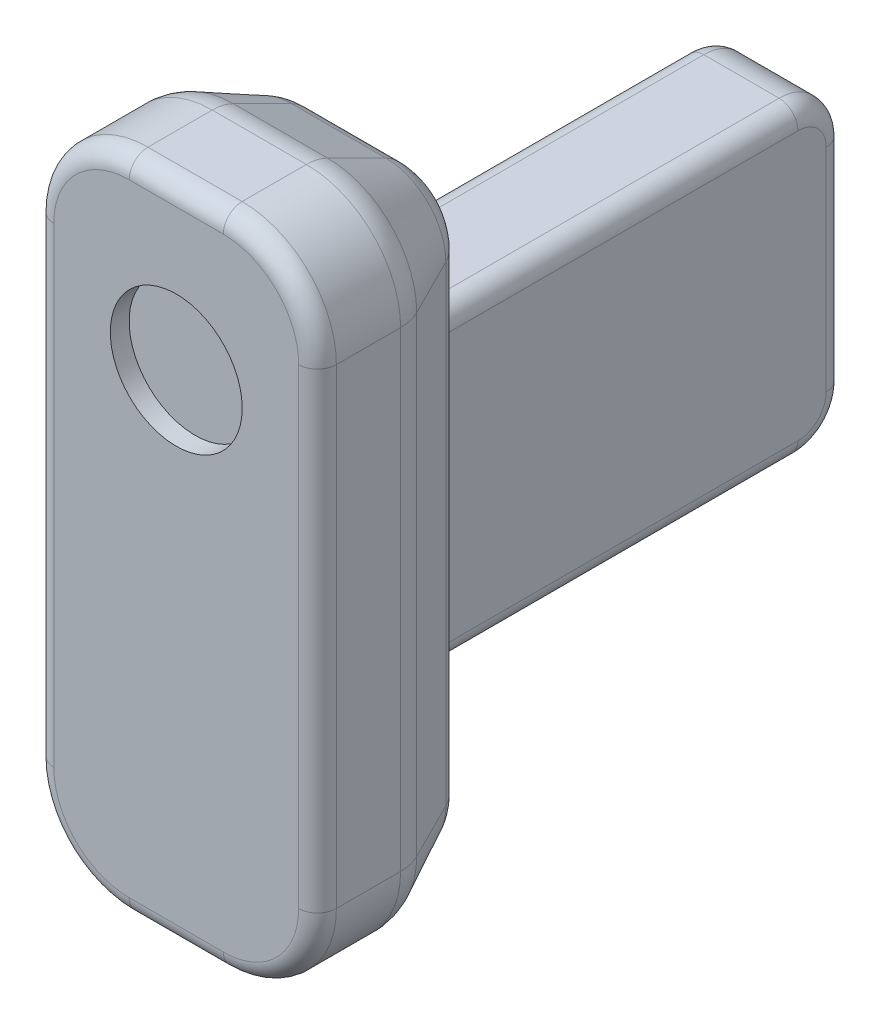
from build123d import *

# Parameters (mm, degrees)
SKETCH1_W           = 30
SKETCH1_H           = 70
BOSS_EXTRUDE1_DEPTH = 20
FILLET1_R           = 10
FILLET2_R           = 2
CHAMFER1_SIZE       = 5
CHAMFER1_SIZE2      = 10
FILLET3_R           = 5
SKETCH2_W           = 12
SKETCH2_H           = 32.5
BOSS_EXTRUDE2_DEPTH = 45
FILLET4_R           = 5
SKETCH3_R           = 7
CUT_EXTRUDE1_DEPTH  = 2
FILLET5_R           = 2


with BuildPart() as part:
    # Sketch1 → Boss-Extrude1 (new body)
    with BuildSketch(Plane.XY):
        with Locations((57.367254616, -81.313756287)):
            Rectangle(SKETCH1_W, SKETCH1_H)
    extrude(amount=-BOSS_EXTRUDE1_DEPTH)

    # Fillet1
    fillet1_edges = [part.edges().sort_by_distance(p)[0] for p in [
        (42.367254616, -46.313756287, -10),
        (72.367254616, -46.313756287, -10),
        (42.367254616, -116.313756287, -10),
        (72.367254616, -116.313756287, -10),
    ]]
    fillet(fillet1_edges, radius=FILLET1_R)

    # Fillet2
    fillet2_edges = [part.edges().sort_by_distance(p)[0] for p in [
        (69.438322428, -113.384824099, 0),
        (57.367254616, -116.313756287, 0),
        (45.296186805, -113.384824099, 0),
        (42.367254616, -81.313756287, 0),
        (45.296186805, -49.242688475, 0),
        (57.367254616, -46.313756287, 0),
        (69.438322428, -49.242688475, 0),
        (72.367254616, -81.313756287, 0),
    ]]
    fillet(fillet2_edges, radius=FILLET2_R)

    # Chamfer1
    chamfer1_edges = [part.edges().sort_by_distance(p)[0] for p in [
        (42.367254616, -81.313756287, -20),
        (45.296186805, -113.384824099, -20),
        (45.296186805, -49.242688475, -20),
        (57.367254616, -116.313756287, -20),
        (57.367254616, -46.313756287, -20),
        (69.438322428, -113.384824099, -20),
        (69.438322428, -49.242688475, -20),
        (72.367254616, -81.313756287, -20),
    ]]
    chamfer1_side = [part.faces().sort_by_distance(p)[0] for p in [
        (57.367254616, -81.313756287, -20),
    ]]
    chamfer(chamfer1_edges, length=CHAMFER1_SIZE, length2=CHAMFER1_SIZE2, reference=chamfer1_side[0])

    # Fillet3
    fillet3_edges = [part.edges().sort_by_distance(p)[0] for p in [
        (65.902788522, -52.778222381, -20),
        (57.367254616, -51.313756287, -20),
        (48.83172071, -52.778222381, -20),
        (47.367254616, -81.313756287, -20),
        (48.83172071, -109.849290193, -20),
        (57.367254616, -111.313756287, -20),
        (65.902788522, -109.849290193, -20),
        (69.438322428, -113.384824099, -10),
        (57.367254616, -116.313756287, -10),
        (45.296186805, -113.384824099, -10),
        (42.367254616, -81.313756287, -10),
        (45.296186805, -49.242688475, -10),
        (57.367254616, -46.313756287, -10),
        (69.438322428, -49.242688475, -10),
        (67.367254616, -81.313756287, -20),
        (72.367254616, -81.313756287, -10),
    ]]
    fillet(fillet3_edges, radius=FILLET3_R)

    # Sketch2 → Boss-Extrude2 (add)
    with BuildSketch(Plane(origin=(0, 0, -20), x_dir=(-1, 0, 0), z_dir=(0, 0, -1))):
        with Locations((-57.367254616, -82.563756287)):
            Rectangle(SKETCH2_W, SKETCH2_H)
    extrude(amount=BOSS_EXTRUDE2_DEPTH)

    # Fillet4
    fillet4_edges = [part.edges().sort_by_distance(p)[0] for p in [
        (57.367254616, -66.313756287, -65),
        (57.367254616, -98.813756287, -65),
    ]]
    fillet(fillet4_edges, radius=FILLET4_R)

    # Sketch3 → Cut-Extrude1 (cut)
    with BuildSketch(Plane.XY):
        with Locations((57.367254616, -63.313756287)):
            Circle(SKETCH3_R)
    extrude(amount=-CUT_EXTRUDE1_DEPTH, mode=Mode.SUBTRACT)

    # Fillet5
    fillet5_edges = [part.edges().sort_by_distance(p)[0] for p in [
        (51.367254616, -66.313756287, -40),
        (51.367254616, -67.778222381, -63.535533906),
        (51.367254616, -82.563756287, -65),
        (51.367254616, -97.349290193, -63.535533906),
        (63.367254616, -66.313756287, -40),
        (63.367254616, -67.778222381, -63.535533906),
        (63.367254616, -82.563756287, -65),
        (63.367254616, -97.349290193, -63.535533906),
        (51.367254616, -98.813756287, -40),
        (63.367254616, -98.813756287, -40),
    ]]
    fillet(fillet5_edges, radius=FILLET5_R)


solid = part.part
